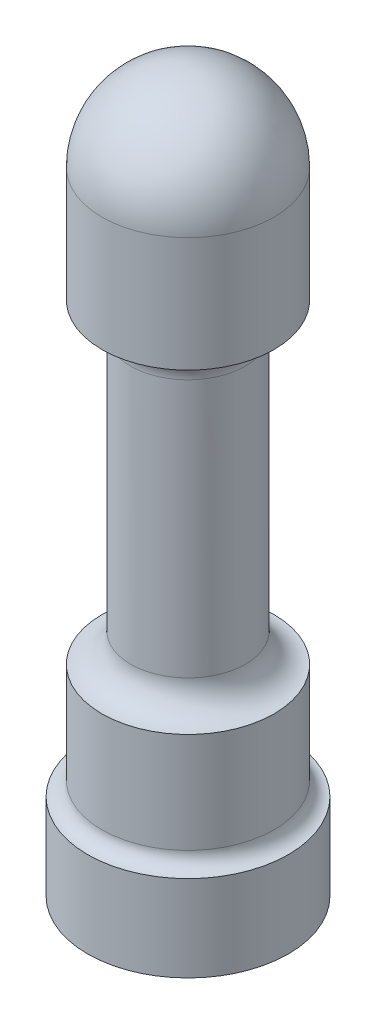
from build123d import *

# Parameters (mm, degrees)
FILLET1_R = 3
FILLET2_R = 1
FILLET3_R = 0.5


with BuildPart() as part:
    # Sketch1 → Revolve1 (revolve)
    with BuildSketch(Plane.XY, mode=Mode.PRIVATE) as revolve1_sk:
        Polygon((0, 0), (3.5, 0), (3.5, 3), (3, 3), (3, 7), (2, 7), (2, 18), (3, 18), (3, 25), (0, 25), align=None)
    revolve(revolve1_sk.sketch.rotate(Axis((0, 25, 0), (0, -1, 0)), 180), axis=Axis((0, 25, 0), (0, -1, 0)))

    # Fillet1
    fillet1_edges = [part.edges().sort_by_distance(p)[0] for p in [
        (3, 25, 0),
    ]]
    fillet(fillet1_edges, radius=FILLET1_R)

    # Fillet2
    fillet2_edges = [part.edges().sort_by_distance(p)[0] for p in [
        (2, 18, 0),
        (2, 7, 0),
    ]]
    fillet(fillet2_edges, radius=FILLET2_R - 0.0001)  # a hair under: the kernel refuses the full size

    # Fillet3
    fillet3_edges = [part.edges().sort_by_distance(p)[0] for p in [
        (3, 3, 0),
    ]]
    fillet(fillet3_edges, radius=FILLET3_R - 0.0001)  # a hair under: the kernel refuses the full size

    # Sketch2 → Cut-Revolve1 (revolve, cut)
    with BuildSketch(Plane.XY, mode=Mode.PRIVATE) as cut_revolve1_sk:
        with BuildLine():
            Line((0, 1.5), (0, 0))
            Line((0, 0), (1.5, 0))
            ThreePointArc((1.5, 0), (1.060660172, 1.060660172), (0, 1.5))
        make_face()
    revolve(cut_revolve1_sk.sketch.rotate(Axis((0, 1.5, 0), (0, -1, 0)), 180), axis=Axis((0, 1.5, 0), (0, -1, 0)), mode=Mode.SUBTRACT)


solid = part.part
